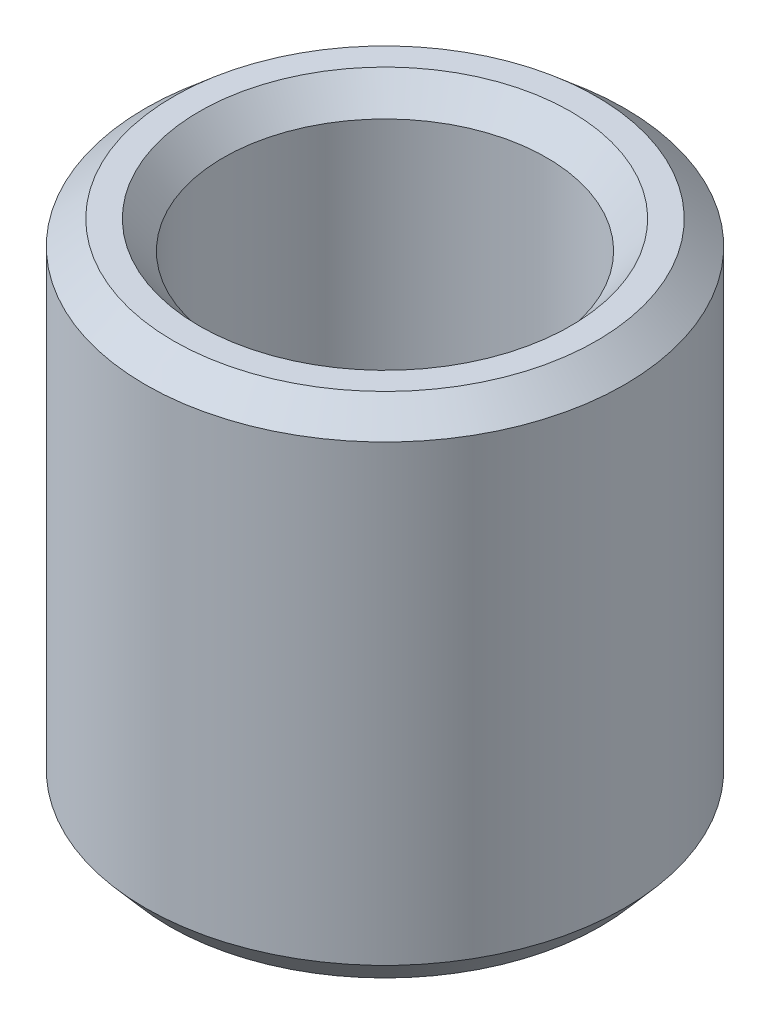
from build123d import *
from OCP.BRepFilletAPI import BRepFilletAPI_MakeChamfer

# Parameters (mm, degrees)
SKETCH1_R           = 22.5
BOSS_EXTRUDE1_DEPTH = 47.458378505
SKETCH2_R           = 15.187078269
CUT_EXTRUDE1_DEPTH  = 58.138408188
CHAMFER1_SIZE       = 2.260412815
CHAMFER1_SIZE2      = 2.622327275


with BuildPart() as part:
    # Sketch1 → Boss-Extrude1 (new body)
    with BuildSketch(Plane(origin=(0, 0, 0), x_dir=(1, 0, 0), z_dir=(0, 1, 0))):
        Circle(SKETCH1_R)
    extrude(amount=BOSS_EXTRUDE1_DEPTH)

    # Sketch2 → Cut-Extrude1 (cut, through all)
    with BuildSketch(Plane(origin=(0, 0, 0), x_dir=(1, 0, 0), z_dir=(0, 1, 0))):
        Circle(SKETCH2_R)
    extrude(amount=CUT_EXTRUDE1_DEPTH, mode=Mode.SUBTRACT)

    # Chamfer1: one chamfer whose edges measure the first distance from different faces: ONE call of the kernel's chamfer builder (chamfer() names one face for all edges)
    chamfer1_edges_1 = [part.edges().sort_by_distance(p)[0] for p in [
        (-15.187078269, 47.458378505, 0),
    ]]
    chamfer1_side_1 = [part.faces().sort_by_distance(p)[0] for p in [
        (-21.863603897, 47.458378505, 0),
    ]]
    chamfer1_edges_2 = [part.edges().sort_by_distance(p)[0] for p in [
        (-15.187078269, 0, 0),
    ]]
    chamfer1_side_2 = [part.faces().sort_by_distance(p)[0] for p in [
        (-15.187078269, 23.729189252, 0),
    ]]
    chamfer1_edges_3 = [part.edges().sort_by_distance(p)[0] for p in [
        (-22.5, 0, 0),
    ]]
    chamfer1_side_3 = [part.faces().sort_by_distance(p)[0] for p in [
        (-21.863603897, 0, 0),
    ]]
    chamfer1_edges_4 = [part.edges().sort_by_distance(p)[0] for p in [
        (-22.5, 47.458378505, 0),
    ]]
    chamfer1_side_4 = [part.faces().sort_by_distance(p)[0] for p in [
        (-22.5, 23.729189252, 0),
    ]]
    chamfer1 = BRepFilletAPI_MakeChamfer(part.part.solid().wrapped)
    for e in chamfer1_edges_1:
        chamfer1.Add(CHAMFER1_SIZE, CHAMFER1_SIZE2, e.wrapped, chamfer1_side_1[0].wrapped)  # the first distance lies on this face
    for e in chamfer1_edges_2:
        chamfer1.Add(CHAMFER1_SIZE, CHAMFER1_SIZE2, e.wrapped, chamfer1_side_2[0].wrapped)  # the first distance lies on this face
    for e in chamfer1_edges_3:
        chamfer1.Add(CHAMFER1_SIZE, CHAMFER1_SIZE2, e.wrapped, chamfer1_side_3[0].wrapped)  # the first distance lies on this face
    for e in chamfer1_edges_4:
        chamfer1.Add(CHAMFER1_SIZE, CHAMFER1_SIZE2, e.wrapped, chamfer1_side_4[0].wrapped)  # the first distance lies on this face
    add(Compound.cast(chamfer1.Shape()), mode=Mode.REPLACE)


solid = part.part
